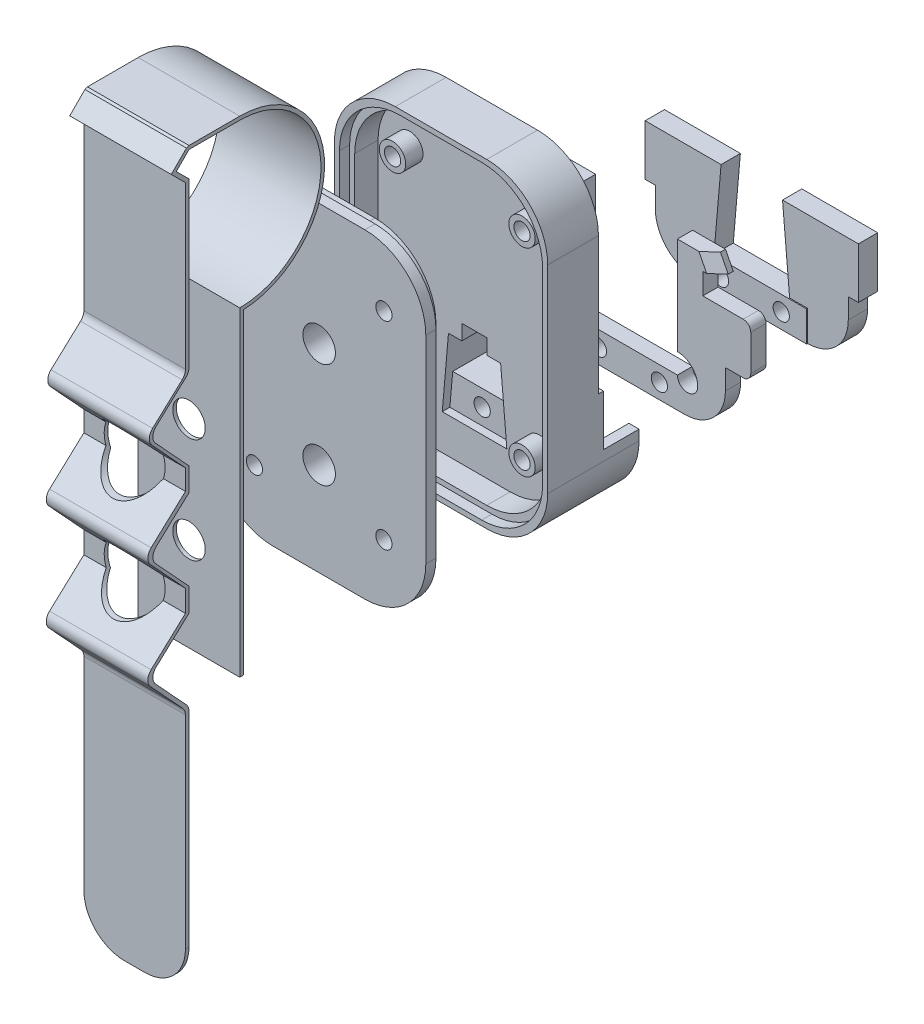
from build123d import *

# Parameters (mm, degrees)
SKETCH_2_W               = 42
SKETCH_2_H               = 63
EXTRUDE_1_DEPTH          = 10
SKETCH_3_W               = 42
SKETCH_3_H               = 24
EXTRUDE_2_DEPTH          = 8
EXTRUDE_3_DEPTH          = 32
SKETCH_5_R               = 0.74
CUT_EXTRUDE_1_DEPTH      = 10
FILLET_1_R               = 3
CUT_EXTRUDE_2_DEPTH      = 7
CUT_EXTRUDE_3_DEPTH      = 7
SKETCH_8_R               = 1.6
CUT_EXTRUDE_4_DEPTH      = 3
FILLET_6_R               = 12
EXTRUDE_START            = -30
SKETCH_10_R              = 1.6
EXTRUDE_7193_DEPTH       = 3
FILLET_2_R               = 1.5
EXTRUDE_START_2          = 50
SKETCH_11_W              = 22
SKETCH_11_H              = 6
EXTRUDE_6_DEPTH          = 0.2
EXTRUDE_START_3          = 3.8
SKETCH_12_W              = 22
SKETCH_12_H              = 6
SKETCH_12_R              = 1.64645215
SKETCH_12_R_2            = 1.6
EXTRUDE_7_DEPTH          = 3.8
CHAMFER_2_SIZE           = 1
SKETCH_25_R              = 1.64645215
SKETCH_25_R_2            = 1.6
CUT_EXTRUDE_12_DEPTH     = 4.2
CHAMFER_9516_SIZE        = 1.5
CHAMFER_9516_SIZE_2      = 17.145078454
EXTRUDE_9952_DEPTH       = 3.8
CUT_EXTRUDE_5_DEPTH      = 6.6
CUT_EXTRUDE_6_DEPTH      = 2
EXTRUDE_START_4          = 20
SKETCH_16_W              = 42
SKETCH_16_H              = 63
EXTRUDE_9_DEPTH          = 4
EXTRUDE_10_DEPTH         = 1
SKETCH_20_W              = 42
SKETCH_20_H              = 63
CUT_EXTRUDE_7_DEPTH      = 2
EXTRUDE_11_DEPTH         = 10
EXTRUDE_11_DEPTH_BACK    = 10
FILLET_3_R               = 2
FILLET_4_R               = 2
CUT_EXTRUDE_8_DEPTH      = 12
CUT_EXTRUDE_8_DEPTH_BACK = 8
SKETCH_22_R              = 6
SKETCH_23_R              = 3.2
CUT_EXTRUDE_10_DEPTH     = 0.7
SKETCH_24_R              = 3.2
CUT_EXTRUDE_11_DEPTH     = 6
FILLET_5_R               = 8
FILLET_7_R               = 12
SKETCH_27_R              = 1.6
CUT_EXTRUDE_13_DEPTH     = 6
SKETCH_28_R              = 1.6
CUT_EXTRUDE_14_DEPTH     = 2
SKETCH_29_R              = 2.6
EXTRUDE_12_DEPTH         = 3.4
SKETCH_32_R              = 1.6
CUT_EXTRUDE_16_DEPTH     = 2.4
CHAMFER_3_SIZE           = 2
EXTRUDE_13_DEPTH         = 1
CUT_EXTRUDE_17_DEPTH     = 11.5
SKETCH_38_W              = 5
SKETCH_38_H              = 5
CUT_EXTRUDE_19_DEPTH     = 3
EXTRUDE_15_DEPTH         = 10
SKETCH_40_R              = 1.6
CUT_EXTRUDE_20_DEPTH     = 10.4


with BuildPart() as part:
    # 草图2 → 凸台-拉伸1 (new body)
    with BuildSketch(Plane.XY):
        Rectangle(SKETCH_2_W, SKETCH_2_H)
    extrude(amount=EXTRUDE_1_DEPTH)

    # 草图3 → 凸台-拉伸2 (add)
    with BuildSketch(Plane(origin=(0, 0, 0), x_dir=(-1, 0, 0), z_dir=(0, 0, -1))):
        with Locations((0, -19.5)):
            Rectangle(SKETCH_3_W, SKETCH_3_H)
    extrude(amount=EXTRUDE_2_DEPTH)

    # 草图4 → 凸台-拉伸3 (add)
    with BuildSketch(Plane(origin=(0, -7.5, 0), x_dir=(1, 0, 0), z_dir=(0, 1, 0))):
        Polygon((-3.5, 0), (0, 0), (0, 3), (-5.5, 3), align=None)
        Polygon((0, 3), (0, 0), (3.5, 0), (5.5, 3), align=None)
    extrude(amount=EXTRUDE_3_DEPTH)

    # 草图5 → 切除-拉伸1 (cut)
    with BuildSketch(Plane(origin=(0, -7.5, 0), x_dir=(1, 0, 0), z_dir=(0, 1, 0))):
        with Locations(Location((-3.81, 6.25, 0), (0, 0, 270))):
            Circle(SKETCH_5_R)
        with Locations(Location((-1.27, 6.25, 0), (0, 0, 270))):
            Circle(SKETCH_5_R)
        with Locations(Location((1.27, 6.25, 0), (0, 0, 270))):
            Circle(SKETCH_5_R)
        with Locations(Location((3.81, 6.25, 0), (0, 0, 270))):
            Circle(SKETCH_5_R)
    extrude(amount=-CUT_EXTRUDE_1_DEPTH, mode=Mode.SUBTRACT)

    # 圆角1
    # the kernel refuses this fillet: 3 mm, written as the material it takes off along each edge
    with BuildSketch(Plane(origin=(-9.660251472, 24.5, -9.240377208), x_dir=(0, -1, 0), z_dir=(0.5547001962252293, 0, 0.8320502943378436))) as fillet_1_piece_1_section:
        with BuildLine():
            CenterArc((FILLET_1_R, FILLET_1_R), FILLET_1_R, 180, 90)
            Line((0, FILLET_1_R), (0, 0))
            Line((0, 0), (FILLET_1_R, 0))
        make_face()
    fillet_1_piece_1 = extrude(amount=18.605551275, mode=Mode.PRIVATE)
    fillet_1_piece_1 = split(fillet_1_piece_1, bisect_by=Plane(origin=(-5.864892725, 23.83506759, 0), z_dir=(0, 0, -1)), keep=Keep.TOP, mode=Mode.PRIVATE)
    add(fillet_1_piece_1, mode=Mode.SUBTRACT)
    with BuildSketch(Plane(origin=(-0.660251472, 24.5, 6.240377208), x_dir=(-0.8320502943378437, 0, -0.5547001962252291), z_dir=(0.5547001962252291, 0, -0.8320502943378437))) as fillet_1_piece_2_section:
        with BuildLine():
            CenterArc((FILLET_1_R, -FILLET_1_R), FILLET_1_R, 90, 90)
            Line((0, -FILLET_1_R), (0, 0))
            Line((0, 0), (FILLET_1_R, 0))
        make_face()
    fillet_1_piece_2 = extrude(amount=18.605551275, mode=Mode.PRIVATE)
    fillet_1_piece_2 = split(fillet_1_piece_2, bisect_by=Plane(origin=(5.864892725, 23.83506759, 0), z_dir=(0, 0, -1)), keep=Keep.TOP, mode=Mode.PRIVATE)
    add(fillet_1_piece_2, mode=Mode.SUBTRACT)

    # 草图6 → 切除-拉伸2 (cut)
    with BuildSketch(Plane(origin=(0, 0, -8), x_dir=(-1, 0, 0), z_dir=(0, 0, -1))):
        with BuildLine():
            Line((-17.55, -7.5), (-21, -7.5))
            Line((-21, -7.5), (-21, -17.5))
            Line((-21, -17.5), (-19, -17.5))
            Line((-19, -17.5), (-19, -21.5))
            ThreePointArc((-19, -21.5), (-16.656854249, -27.156854249), (-11, -29.5))
            Line((-11, -29.5), (-9.55, -29.5))
            Line((-9.55, -29.5), (0, -29.5))
            Line((0, -29.5), (9.55, -29.5))
            Line((9.55, -29.5), (11, -29.5))
            ThreePointArc((11, -29.5), (16.656854249, -27.156854249), (19, -21.5))
            Line((19, -21.5), (19, -17.5))
            Line((19, -17.5), (21, -17.5))
            Line((21, -17.5), (21, -7.5))
            Line((21, -7.5), (17.55, -7.5))
            Line((17.55, -7.5), (14.55, -7.5))
            Line((14.55, -7.5), (9.55, -7.5))
            Line((9.55, -7.5), (9.55, -19.5))
            ThreePointArc((9.55, -19.5), (12.378427125, -20.671572875), (13.55, -23.5))
            ThreePointArc((13.55, -23.5), (11.55, -25.5), (9.55, -23.5))
            Line((9.55, -23.5), (0, -23.5))
            Line((0, -23.5), (-9.55, -23.5))
            ThreePointArc((-9.55, -23.5), (-11.55, -25.5), (-13.55, -23.5))
            ThreePointArc((-13.55, -23.5), (-12.378427125, -20.671572875), (-9.55, -19.5))
            Line((-9.55, -19.5), (-9.55, -7.5))
            Line((-9.55, -7.5), (-14.55, -7.5))
            Line((-14.55, -7.5), (-17.55, -7.5))
        make_face()
    extrude(amount=-CUT_EXTRUDE_2_DEPTH, mode=Mode.SUBTRACT)

    # 草图7 → 切除-拉伸3 (cut)
    with BuildSketch(Plane(origin=(0, 0, -8), x_dir=(-1, 0, 0), z_dir=(0, 0, -1))):
        with BuildLine():
            Line((-7.55, -7.5), (-9.55, -7.5))
            Line((-9.55, -7.5), (-9.55, -19.5))
            ThreePointArc((-9.55, -19.5), (-12.378427125, -20.671572875), (-13.55, -23.5))
            ThreePointArc((-13.55, -23.5), (-12.964213562, -24.914213562), (-11.55, -25.5))
            ThreePointArc((-11.55, -25.5), (-10.135786438, -24.914213562), (-9.55, -23.5))
            Line((-9.55, -23.5), (-7.55, -23.5))
            Line((-7.55, -23.5), (-7.55, -7.5))
        make_face()
        with BuildLine():
            Line((9.55, -7.5), (7.55, -7.5))
            Line((7.55, -7.5), (7.55, -23.5))
            Line((7.55, -23.5), (9.55, -23.5))
            ThreePointArc((9.55, -23.5), (10.135786438, -24.914213562), (11.55, -25.5))
            ThreePointArc((11.55, -25.5), (12.964213562, -24.914213562), (13.55, -23.5))
            ThreePointArc((13.55, -23.5), (12.378427125, -20.671572875), (9.55, -19.5))
            Line((9.55, -19.5), (9.55, -7.5))
        make_face()
    extrude(amount=-CUT_EXTRUDE_3_DEPTH, mode=Mode.SUBTRACT)

    # 草图8 → 切除-拉伸4 (cut)
    with BuildSketch(Plane(origin=(0, 0, -1), x_dir=(-1, 0, 0), z_dir=(0, 0, -1))):
        with Locations((-6, -26.5)):
            Circle(SKETCH_8_R)
        with Locations((6, -26.5)):
            Circle(SKETCH_8_R)
    extrude(amount=-CUT_EXTRUDE_4_DEPTH, mode=Mode.SUBTRACT)

    # 圆角6
    fillet_6_edges = [part.edges().sort_by_distance(p)[0] for p in [
        (21, -31.5, 1),
        (-21, -31.5, 1),
        (-21, 31.5, 5),
        (21, 31.5, 5),
    ]]
    fillet(fillet_6_edges, radius=FILLET_6_R)

    # Chamfer 9516
    # the kernel refuses this chamfer: 17.145078454, 1.5 mm, written as the material it takes off along each edge
    with BuildSketch(Plane(origin=(7.55, -7.5, -52.570930251), x_dir=(-0.9159861691531067, 0.4012098427509178, 0), z_dir=(0, 0, 1))) as chamfer_9516_piece_1:
        Polygon((CHAMFER_9516_SIZE * 0.915986169153, CHAMFER_9516_SIZE * 0.401209842751), (-CHAMFER_9516_SIZE_2 * 0.401209842754, CHAMFER_9516_SIZE_2 * 0.915986169161), (0, 0), align=None)
    extrude(amount=51.570930251, mode=Mode.SUBTRACT)
    with BuildSketch(Plane(origin=(-7.55, -7.5, -52.570930251), x_dir=(0.9159861691531067, 0.4012098427509178, 0), z_dir=(0, 0, 1))) as chamfer_9516_piece_2:
        Polygon((CHAMFER_9516_SIZE * 0.915986169153, -CHAMFER_9516_SIZE * 0.401209842751), (-CHAMFER_9516_SIZE_2 * 0.401209842754, -CHAMFER_9516_SIZE_2 * 0.915986169161), (0, 0), align=None)
    extrude(amount=51.570930251, mode=Mode.SUBTRACT)

    # 草图14 → 切除-拉伸5 (cut)
    with BuildSketch(Plane.XY.offset(10)):
        with BuildLine():
            Line((-7, -29.5), (7, -29.5))
            ThreePointArc((7, -29.5), (15.485281374, -25.985281374), (19, -17.5))
            Line((19, -17.5), (19, 17.5))
            ThreePointArc((19, 17.5), (15.485281374, 25.985281374), (7, 29.5))
            Line((7, 29.5), (-7, 29.5))
            ThreePointArc((-7, 29.5), (-15.485281374, 25.985281374), (-19, 17.5))
            Line((-19, 17.5), (-19, -17.5))
            ThreePointArc((-19, -17.5), (-15.485281374, -25.985281374), (-7, -29.5))
        make_face()
    extrude(amount=-CUT_EXTRUDE_5_DEPTH, mode=Mode.SUBTRACT)

    # 草图15 → 切除-拉伸6 (cut)
    with BuildSketch(Plane.XY.offset(10)):
        with BuildLine():
            Line((-8, -30.5), (8, -30.5))
            ThreePointArc((8, -30.5), (16.485281374, -26.985281374), (20, -18.5))
            Line((20, -18.5), (20, 18.5))
            ThreePointArc((20, 18.5), (16.485281374, 26.985281374), (8, 30.5))
            Line((8, 30.5), (-8, 30.5))
            ThreePointArc((-8, 30.5), (-16.485281374, 26.985281374), (-20, 18.5))
            Line((-20, 18.5), (-20, -18.5))
            ThreePointArc((-20, -18.5), (-16.485281374, -26.985281374), (-8, -30.5))
        make_face()
    extrude(amount=-CUT_EXTRUDE_6_DEPTH, mode=Mode.SUBTRACT)

    # 草图28 → 切除-拉伸14 (cut)
    with BuildSketch(Plane.XY.offset(3.4)):
        with Locations((-12.75, 19.525931249)):
            Circle(SKETCH_28_R)
        with Locations((12.75, 19.525931249)):
            Circle(SKETCH_28_R)
        with Locations((12.75, -19.5)):
            Circle(SKETCH_28_R)
        with Locations((-12.75, -19.5)):
            Circle(SKETCH_28_R)
    extrude(amount=-CUT_EXTRUDE_14_DEPTH, mode=Mode.SUBTRACT)

    # 草图29 → 凸台-拉伸12 (add)
    with BuildSketch(Plane.XY.offset(3.4)):
        with Locations(Location((12.75, 19.525931249, 0), (0, 0, 180))):
            Circle(SKETCH_29_R)
        with Locations(Location((-12.75, 19.525931249, 0), (0, 0, 180))):
            Circle(SKETCH_29_R)
        with Locations(Location((-12.75, -19.5, 0), (0, 0, 180))):
            Circle(SKETCH_29_R)
        with Locations(Location((12.75, -19.5, 0), (0, 0, 180))):
            Circle(SKETCH_29_R)
    extrude(amount=EXTRUDE_12_DEPTH)

    # 草图32 → 切除-拉伸16 (cut)
    with BuildSketch(Plane.XY.offset(6.8)):
        with Locations((-12.75, 19.525931249)):
            Circle(SKETCH_32_R)
        with Locations((12.75, 19.525931249)):
            Circle(SKETCH_32_R)
        with Locations((12.75, -19.5)):
            Circle(SKETCH_32_R)
        with Locations((-12.75, -19.5)):
            Circle(SKETCH_32_R)
    extrude(amount=-CUT_EXTRUDE_16_DEPTH, mode=Mode.SUBTRACT)

    # 草图35 → 凸台-拉伸13 (add)
    with BuildSketch(Plane(origin=(0, 0, -8), x_dir=(-1, 0, 0), z_dir=(0, 0, -1))):
        Polygon((-6.05, -7.5), (-7.449818616, -23.5), (7.449818616, -23.5), (6.05, -7.5), align=None)
    extrude(amount=EXTRUDE_13_DEPTH)

    # 草图36 → 切除-拉伸17 (cut)
    with BuildSketch(Plane.XY.offset(3.4)):
        Polygon((6.358510115, -22.5), (5.133668826, -8.5), (-5.133668826, -8.5), (-6.358510115, -22.5), align=None)
    extrude(amount=-CUT_EXTRUDE_17_DEPTH, mode=Mode.SUBTRACT)

    # 草图38 → 切除-拉伸19 (cut)
    with BuildSketch(Plane(origin=(0, -8.5, 0), x_dir=(-1, 0, 0), z_dir=(0, -1, 0))):
        with Locations((0, -0.9)):
            Rectangle(SKETCH_38_W, SKETCH_38_H)
    extrude(amount=-CUT_EXTRUDE_19_DEPTH, mode=Mode.SUBTRACT)

    # 草图39 → 凸台-拉伸15 (add)
    with BuildSketch(Plane.XY.offset(-8.1)):
        Polygon((0, -16.1), (5.798582669, -16.1), (6.358510115, -22.5), (-6.358510115, -22.5), (-5.798582669, -16.1), align=None)
    extrude(amount=EXTRUDE_15_DEPTH)

    # 草图40 → 切除-拉伸20 (cut)
    with BuildSketch(Plane.XY.offset(1.9)):
        with Locations((0, -19.3)):
            Circle(SKETCH_40_R)
    extrude(amount=-CUT_EXTRUDE_20_DEPTH, mode=Mode.SUBTRACT)


with BuildPart() as body_2:
    # 草图10 → Extrude 7193 (new body)
    with BuildSketch(Plane.XY.offset(EXTRUDE_START)):
        with BuildLine():
            Line((-24, -17.5), (-19, -17.5))
            Line((-19, -17.5), (-19, -21.5))
            ThreePointArc((-19, -21.5), (-16.656854249, -27.156854249), (-11, -29.5))
            Line((-11, -29.5), (11, -29.5))
            ThreePointArc((11, -29.5), (16.656854249, -27.156854249), (19, -21.5))
            Line((19, -21.5), (19, -17.5))
            Line((19, -17.5), (24, -17.5))
            Line((24, -17.5), (24, -7.5))
            Line((24, -7.5), (14.55, -7.5))
            Line((14.55, -7.5), (14.55, -3.3))
            Line((14.55, -3.3), (17.55, -3.3))
            Line((17.55, -3.3), (16.031012658, -0.3))
            Line((16.031012658, -0.3), (9.55, -0.3))
            Line((9.55, -0.3), (9.55, -19.5))
            ThreePointArc((9.55, -19.5), (12.378427125, -20.671572875), (13.55, -23.5))
            ThreePointArc((13.55, -23.5), (11.55, -25.5), (9.55, -23.5))
            Line((9.55, -23.5), (-9.55, -23.5))
            ThreePointArc((-9.55, -23.5), (-11.55, -25.5), (-13.55, -23.5))
            ThreePointArc((-13.55, -23.5), (-12.378427125, -20.671572875), (-9.55, -19.5))
            Line((-9.55, -19.5), (-9.55, -0.3))
            Line((-9.55, -0.3), (-16.031012658, -0.3))
            Line((-16.031012658, -0.3), (-17.55, -3.3))
            Line((-17.55, -3.3), (-14.55, -3.3))
            Line((-14.55, -3.3), (-14.55, -7.5))
            Line((-14.55, -7.5), (-24, -7.5))
            Line((-24, -7.5), (-24, -17.5))
        make_face()
        with Locations((6, -26.5)):
            Circle(SKETCH_10_R, mode=Mode.SUBTRACT)
        with Locations((-6, -26.5)):
            Circle(SKETCH_10_R, mode=Mode.SUBTRACT)
    extrude(amount=EXTRUDE_7193_DEPTH)

    # 圆角2
    fillet_2_edges = [body_2.edges().sort_by_distance(p)[0] for p in [
        (24, -7.5, -28.5),
        (24, -17.5, -28.5),
        (-24, -17.5, -28.5),
        (-24, -7.5, -28.5),
    ]]
    fillet(fillet_2_edges, radius=FILLET_2_R)

    # 倒角3
    chamfer_3_edges = [body_2.edges().sort_by_distance(p)[0] for p in [
        (16.790506329, -1.8, -27),
        (-16.790506329, -1.8, -27),
    ]]
    chamfer(chamfer_3_edges, length=CHAMFER_3_SIZE)


with BuildPart() as body_3:
    # 草图11 → 凸台-拉伸6 (new body)
    with BuildSketch(Plane(origin=(0, 0, -1), x_dir=(-1, 0, 0), z_dir=(0, 0, -1)).offset(EXTRUDE_START_2)):
        with Locations((0, -26.5)):
            Rectangle(SKETCH_11_W, SKETCH_11_H)
    extrude(amount=EXTRUDE_6_DEPTH)

    # 草图12 → 凸台-拉伸7 (add)
    # profile 1 of 3: a face of its own
    with BuildSketch(Plane(origin=(0, 0, -51.2), x_dir=(-1, 0, 0), z_dir=(0, 0, -1)).offset(EXTRUDE_START_3)):
        with BuildLine():
            ThreePointArc((-19, -21.5), (-16.656854249, -27.156854249), (-11, -29.5))
            Line((-11, -29.5), (-11, -23.5))
            Line((-11, -23.5), (-7.55, -23.5))
            Line((-7.55, -23.5), (-7.55, -14.282140206))
            Line((-7.55, -14.282140206), (-7.55, -7.5))
            Line((-7.55, -7.5), (-21, -7.5))
            Line((-21, -7.5), (-21, -17.5))
            Line((-21, -17.5), (-19, -17.5))
            Line((-19, -17.5), (-19, -21.5))
        make_face()
    # profile 2 of 3: a face of its own
    with BuildSketch(Plane(origin=(0, 0, -51.2), x_dir=(-1, 0, 0), z_dir=(0, 0, -1)).offset(EXTRUDE_START_3)):
        with Locations((0, -26.5)):
            Rectangle(SKETCH_12_W, SKETCH_12_H)
        with Locations(Location((6, -26.5, 0), (0, 0, 180))):
            Circle(SKETCH_12_R, mode=Mode.SUBTRACT)
        with Locations(Location((-6, -26.5, 0), (0, 0, 180))):
            Circle(SKETCH_12_R_2, mode=Mode.SUBTRACT)
    # profile 3 of 3: a face of its own
    with BuildSketch(Plane(origin=(0, 0, -51.2), x_dir=(-1, 0, 0), z_dir=(0, 0, -1)).offset(EXTRUDE_START_3)):
        with BuildLine():
            Line((11, -23.5), (11, -29.5))
            ThreePointArc((11, -29.5), (16.656854249, -27.156854249), (19, -21.5))
            Line((19, -21.5), (19, -17.5))
            Line((19, -17.5), (21, -17.5))
            Line((21, -17.5), (21, -7.5))
            Line((21, -7.5), (7.55, -7.5))
            Line((7.55, -7.5), (7.55, -23.5))
            Line((7.55, -23.5), (11, -23.5))
        make_face()
    extrude(amount=-EXTRUDE_7_DEPTH)

    # 倒角2
    chamfer_2_edges = [body_3.edges().sort_by_distance(p)[0] for p in [
        (-7.64645215, -26.5, -55),
        (4.4, -26.5, -55),
    ]]
    chamfer(chamfer_2_edges, length=CHAMFER_2_SIZE)

    # 草图25 → 切除-拉伸12 (cut)
    with BuildSketch(Plane(origin=(0, 0, -55), x_dir=(-1, 0, 0), z_dir=(0, 0, -1))):
        with Locations(Location((6, -26.5, 0), (0, 0, 180))):
            Circle(SKETCH_25_R)
        with Locations(Location((-6, -26.5, 0), (0, 0, 180))):
            Circle(SKETCH_25_R_2)
    extrude(amount=-CUT_EXTRUDE_12_DEPTH, mode=Mode.SUBTRACT)

    # 草图13 → Extrude 9952 (add)
    with BuildSketch(Plane(origin=(0, 0, -55), x_dir=(-1, 0, 0), z_dir=(0, 0, -1))):
        Polygon((-6.05, -7.5), (-7.449818616, -23.5), (-7.55, -23.5), (-7.55, -7.5), align=None)
        Polygon((6.05, -7.5), (7.55, -7.5), (7.55, -23.5), (7.449818616, -23.5), align=None)
    extrude(amount=-EXTRUDE_9952_DEPTH)


with BuildPart() as body_4:
    # 草图16 → 凸台-拉伸9 (new body)
    with BuildSketch(Plane.XY.offset(10).offset(EXTRUDE_START_4)):
        Rectangle(SKETCH_16_W, SKETCH_16_H)
    extrude(amount=EXTRUDE_9_DEPTH)

    # 草图19 → 凸台-拉伸10 (add)
    with BuildSketch(Plane(origin=(0, 0, 30), x_dir=(-1, 0, 0), z_dir=(0, 0, -1))):
        with BuildLine():
            Line((-6, -28.5), (6, -28.5))
            ThreePointArc((6, -28.5), (14.485281374, -24.985281374), (18, -16.5))
            Line((18, -16.5), (18, 16.5))
            ThreePointArc((18, 16.5), (14.485281374, 24.985281374), (6, 28.5))
            Line((6, 28.5), (-6, 28.5))
            ThreePointArc((-6, 28.5), (-14.485281374, 24.985281374), (-18, 16.5))
            Line((-18, 16.5), (-18, -16.5))
            ThreePointArc((-18, -16.5), (-14.485281374, -24.985281374), (-6, -28.5))
        make_face()
    extrude(amount=EXTRUDE_10_DEPTH)

    # 草图20 → 切除-拉伸7 (cut)
    with BuildSketch(Plane(origin=(0, 0, 30), x_dir=(-1, 0, 0), z_dir=(0, 0, -1))):
        Rectangle(SKETCH_20_W, SKETCH_20_H)
        with BuildLine():
            Line((-7, -30.5), (7, -30.5))
            ThreePointArc((7, -30.5), (15.485281374, -26.985281374), (19, -18.5))
            Line((19, -18.5), (19, 18.5))
            ThreePointArc((19, 18.5), (15.485281374, 26.985281374), (7, 30.5))
            Line((7, 30.5), (-7, 30.5))
            ThreePointArc((-7, 30.5), (-15.485281374, 26.985281374), (-19, 18.5))
            Line((-19, 18.5), (-19, -18.5))
            ThreePointArc((-19, -18.5), (-15.485281374, -26.985281374), (-7, -30.5))
        make_face(mode=Mode.SUBTRACT)
    extrude(amount=-CUT_EXTRUDE_7_DEPTH, mode=Mode.SUBTRACT)

    # 草图24 → 切除-拉伸11 (cut)
    with BuildSketch(Plane.XY.offset(34)):
        with Locations((0, 7.555855621)):
            Circle(SKETCH_24_R)
        with Locations((0, -13.112379601)):
            Circle(SKETCH_24_R)
    extrude(amount=-CUT_EXTRUDE_11_DEPTH, mode=Mode.SUBTRACT)

    # 圆角7
    fillet_7_edges = [body_4.edges().sort_by_distance(p)[0] for p in [
        (21, -31.5, 33),
        (-21, -31.5, 33),
        (-21, 31.5, 33),
        (21, 31.5, 33),
    ]]
    fillet(fillet_7_edges, radius=FILLET_7_R)

    # 草图27 → 切除-拉伸13 (cut)
    with BuildSketch(Plane.XY.offset(34)):
        with Locations((-12.75, 19.525931249)):
            Circle(SKETCH_27_R)
        with Locations((12.75, 19.525931249)):
            Circle(SKETCH_27_R)
        with Locations((12.75, -19.5)):
            Circle(SKETCH_27_R)
        with Locations((-12.75, -19.5)):
            Circle(SKETCH_27_R)
    extrude(amount=-CUT_EXTRUDE_13_DEPTH, mode=Mode.SUBTRACT)


with BuildPart() as body_5:
    # 草图21 → 凸台-拉伸11 (new, two sides: drawn at the far end of the back side and taken through both)
    with BuildSketch(Plane(origin=(0, 0, 0), x_dir=(0, 0, -1), z_dir=(1, 0, 0)).offset(-EXTRUDE_11_DEPTH_BACK)):
        with BuildLine():
            Line((-59.6372278, -31.5), (-59.6372278, 31.5))
            ThreePointArc((-59.6372278, 31.5), (-43.641058217, 47.14991619), (-58.9372278, 63.484680166))
            Line((-58.9372278, 63.484680166), (-59.6372278, 63.5))
            Line((-59.6372278, 63.5), (-69.6372278, 63.5))
            Line((-69.6372278, 63.5), (-72.1372278, 61))
            Line((-72.1372278, 61), (-69.6372278, 58.5))
            Line((-69.6372278, 58.5), (-69.6372278, 25.5))
            Line((-69.6372278, 25.5), (-77.579345381, 18.179037109))
            Line((-77.579345381, 18.179037109), (-69.6372278, 9.563062324))
            Line((-69.6372278, 9.563062324), (-69.6372278, 4.968468838))
            Line((-69.6372278, 4.968468838), (-77.579345381, -2.352494053))
            Line((-77.579345381, -2.352494053), (-69.6372278, -10.968468838))
            Line((-69.6372278, -10.968468838), (-69.6372278, -15.563062324))
            Line((-69.6372278, -15.563062324), (-77.579345381, -22.884025215))
            Line((-77.579345381, -22.884025215), (-69.6372278, -31.5))
            Line((-69.6372278, -31.5), (-69.6372278, -80.5))
            Line((-69.6372278, -80.5), (-70.3372278, -80.5))
            Line((-70.3372278, -80.5), (-70.3372278, -31.773408119))
            Line((-70.3372278, -31.773408119), (-78.56847611, -22.843771009))
            Line((-78.56847611, -22.843771009), (-70.3372278, -15.256290364))
            Line((-70.3372278, -15.256290364), (-70.3372278, -10.968468838))
            Line((-70.3372278, -10.968468838), (-78.56847611, -2.038831728))
            Line((-78.56847611, -2.038831728), (-70.3372278, 5.548648917))
            Line((-70.3372278, 5.548648917), (-70.3372278, 9.563062324))
            Line((-70.3372278, 9.563062324), (-78.279345381, 18.179037109))
            Line((-78.279345381, 18.179037109), (-70.3372278, 25.5))
            Line((-70.3372278, 25.5), (-70.3372278, 58.210050506))
            Line((-70.3372278, 58.210050506), (-73.127177293, 61))
            Line((-73.127177293, 61), (-70.132202547, 63.994974747))
            Line((-70.132202547, 63.994974747), (-69.6372278, 64.2))
            Line((-69.6372278, 64.2), (-59.6372278, 64.2))
            ThreePointArc((-59.6372278, 64.2), (-42.94089748, 47.850076926), (-58.9372278, 30.814677108))
            Line((-58.9372278, 30.814677108), (-58.9372278, -31.5))
            Line((-58.9372278, -31.5), (-59.6372278, -31.5))
        make_face()
    extrude(amount=EXTRUDE_11_DEPTH + EXTRUDE_11_DEPTH_BACK)

    # 圆角3
    fillet_3_edges = [body_5.edges().sort_by_distance(p)[0] for p in [
        (0, 18.179037109, 77.579345381),
        (0, -2.352494053, 77.579345381),
        (0, -22.884025215, 77.579345381),
    ]]
    fillet(fillet_3_edges, radius=FILLET_3_R)

    # 圆角4
    fillet_4_edges = [body_5.edges().sort_by_distance(p)[0] for p in [
        (0, 25.5, 69.6372278),
        (0, -31.5, 69.6372278),
        (0, -31.773408119, 70.3372278),
        (0, -22.843771009, 78.56847611),
        (0, -2.038831728, 78.56847611),
        (0, 18.179037109, 78.279345381),
        (0, 25.5, 70.3372278),
    ]]
    fillet(fillet_4_edges, radius=FILLET_4_R)

    # 草图22 → 切除-拉伸8 (cut, two sides: drawn at the far end of the back side and taken through both)
    with BuildSketch(Plane.XY.offset(70.3372278).offset(-CUT_EXTRUDE_8_DEPTH_BACK)):
        with Locations(Location((0, 7.555855621, 0), (0, 0, 160.45576938))):
            Circle(SKETCH_22_R)
        with Locations(Location((0, -13.112379601, 0), (0, 0, 159.064395454))):
            Circle(SKETCH_22_R)
    extrude(amount=CUT_EXTRUDE_8_DEPTH + CUT_EXTRUDE_8_DEPTH_BACK, mode=Mode.SUBTRACT)

    # 草图23 → 切除-拉伸10 (cut)
    with BuildSketch(Plane.XY.offset(59.6372278)):
        with Locations((0, 7.555855621)):
            Circle(SKETCH_23_R)
        with Locations((0, -13.112379601)):
            Circle(SKETCH_23_R)
    extrude(amount=-CUT_EXTRUDE_10_DEPTH, mode=Mode.SUBTRACT)

    # 圆角5
    fillet_5_edges = [body_5.edges().sort_by_distance(p)[0] for p in [
        (-10, -80.5, 69.9872278),
        (10, -80.5, 69.9872278),
    ]]
    fillet(fillet_5_edges, radius=FILLET_5_R)


solid = Compound([part.part, body_2.part, body_3.part, body_4.part, body_5.part])
